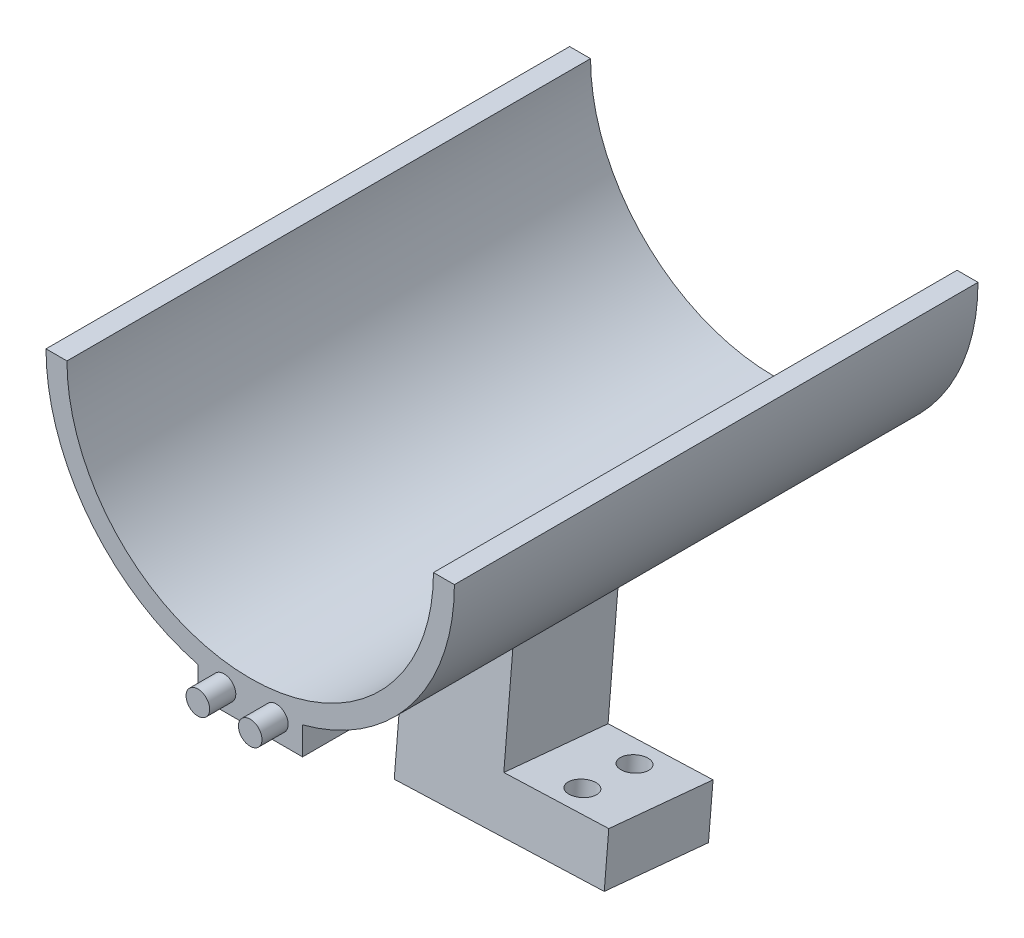
from build123d import *

# Parameters (mm, degrees)
EXTRUDE_THIN1_DEPTH       = 100
BOSS_EXTRUDE1_START       = -10
BOSS_EXTRUDE1_DEPTH       = 10
SKETCH3_R                 = 2.25
BOSS_EXTRUDE2_DEPTH       = 5
BOSS_EXTRUDE3_DEPTH       = 10
SKETCH5_R                 = 2.25
CUT_EXTRUDE1_DEPTH        = 6
BOSS_EXTRUDE4_REACH       = 121.416
BOSS_EXTRUDE4_END_RADIUS  = 39
SKETCH10_W                = 20
SKETCH10_H                = 20
BOSS_EXTRUDE5_START       = -29.189050103
BOSS_EXTRUDE5_OUTLINE_W   = 20
BOSS_EXTRUDE5_OUTLINE_H   = 20
BOSS_EXTRUDE5_DEPTH       = 29.189050103
BOSS_EXTRUDE5_START_2     = 80.604897745
BOSS_EXTRUDE5_2_OUTLINE_W = 23
BOSS_EXTRUDE5_2_OUTLINE_H = 23
BOSS_EXTRUDE5_2_DEPTH     = 1.395102255
BOSS_EXTRUDE6_DEPTH       = 20
SKETCH12_R                = 2.5
CUT_EXTRUDE2_DEPTH        = 20


with BuildPart() as part:
    # Sketch1 → Extrude-Thin1 (new body)
    with BuildSketch(Plane.XY):
        with BuildLine():
            ThreePointArc((-35, 0), (0, -35), (35, 0))
            Line((35, 0), (39, 0))
            ThreePointArc((39, 0), (0, -39), (-39, 0))
            Line((-39, 0), (-35, 0))
        make_face()
    extrude(amount=EXTRUDE_THIN1_DEPTH)

    # Sketch2 → Boss-Extrude1 (add)
    with BuildSketch(Plane.XY.offset(100).offset(BOSS_EXTRUDE1_START)):
        with BuildLine():
            Line((0, -39), (0, -35))
            Line((0, -35), (-10, -35))
            Line((-10, -35), (-10, -37.69615365))
            ThreePointArc((-10, -37.69615365), (-5.042321274, -38.672664715), (0, -39))
        make_face()
        with BuildLine():
            Line((10, -35), (0, -35))
            Line((0, -35), (0, -39))
            ThreePointArc((0, -39), (5.042321274, -38.672664715), (10, -37.69615365))
            Line((10, -37.69615365), (10, -35))
        make_face()
        with BuildLine():
            ThreePointArc((10, -37.69615365), (5.042321274, -38.672664715), (0, -39))
            ThreePointArc((0, -39), (-5.042321274, -38.672664715), (-10, -37.69615365))
            Line((-10, -37.69615365), (-10, -43))
            Line((-10, -43), (10, -43))
            Line((10, -43), (10, -37.69615365))
        make_face()
    extrude(amount=BOSS_EXTRUDE1_DEPTH)

    # Sketch3 → Boss-Extrude2 (add)
    with BuildSketch(Plane.XY.offset(100)):
        with Locations((-5, -39)):
            Circle(SKETCH3_R)
        with Locations((5, -39)):
            Circle(SKETCH3_R)
    extrude(amount=BOSS_EXTRUDE2_DEPTH)

    # Sketch4 → Boss-Extrude3 (add)
    with BuildSketch(Plane(origin=(0, 0, 0), x_dir=(-1, 0, 0), z_dir=(0, 0, -1))):
        with BuildLine():
            Line((0, -39), (0, -35))
            Line((0, -35), (-10, -35))
            Line((-10, -35), (-10, -37.69615365))
            ThreePointArc((-10, -37.69615365), (-5.042321274, -38.672664715), (0, -39))
        make_face()
        with BuildLine():
            ThreePointArc((10, -37.69615365), (5.042321274, -38.672664715), (0, -39))
            ThreePointArc((0, -39), (-5.042321274, -38.672664715), (-10, -37.69615365))
            Line((-10, -37.69615365), (-10, -43))
            Line((-10, -43), (10, -43))
            Line((10, -43), (10, -37.69615365))
        make_face()
        with BuildLine():
            Line((10, -35), (0, -35))
            Line((0, -35), (0, -39))
            ThreePointArc((0, -39), (5.042321274, -38.672664715), (10, -37.69615365))
            Line((10, -37.69615365), (10, -35))
        make_face()
    extrude(amount=-BOSS_EXTRUDE3_DEPTH)

    # Sketch5 → Cut-Extrude1 (cut)
    with BuildSketch(Plane(origin=(0, 0, 0), x_dir=(-1, 0, 0), z_dir=(0, 0, -1))):
        with Locations(Location((-5, -39, 0), (0, 0, 180))):
            Circle(SKETCH5_R)
        with Locations(Location((5, -39, 0), (0, 0, 180))):
            Circle(SKETCH5_R)
    extrude(amount=-CUT_EXTRUDE1_DEPTH, mode=Mode.SUBTRACT)

    # Boss-Extrude4: up to this cylinder (the profile starts outside it)
    boss_extrude4_end = Plane(origin=(0, 0, 50), z_dir=(0, 0, -1)) * Cylinder(BOSS_EXTRUDE4_END_RADIUS, 321.832, mode=Mode.PRIVATE)
    # Sketch10 → Boss-Extrude4 (add, up to the surface)
    with BuildSketch(Plane(origin=(0, -51.355775573, 4.493048169), x_dir=(1, 0, 0), z_dir=(0, 0.9961946980917462, -0.08715574274765152)), mode=Mode.PRIVATE) as boss_extrude4_sk1:
        with Locations((0, -45.680780994)):
            Rectangle(SKETCH10_W, SKETCH10_H)
    boss_extrude4_tool1 = extrude(boss_extrude4_sk1.sketch, amount=BOSS_EXTRUDE4_REACH, mode=Mode.PRIVATE) - boss_extrude4_end
    add(boss_extrude4_tool1.solids().sort_by_distance((0, -47.374433, 50))[0])

    # Boss-Extrude5: read off the stored shape, not the designer's step
    # Boss-Extrude5 outline → Boss-Extrude5 (add)
    with BuildSketch(Plane(origin=(0, -51.355775573, 4.493048169), x_dir=(1, 0, 0), z_dir=(0, 0.9961946980917462, -0.08715574274765152)).offset(BOSS_EXTRUDE5_START)):
        with Locations((0, -45.680780994)):
            Rectangle(BOSS_EXTRUDE5_OUTLINE_W, BOSS_EXTRUDE5_OUTLINE_H)
    extrude(amount=BOSS_EXTRUDE5_DEPTH)

    # Boss-Extrude5 2 outline → Boss-Extrude5 2 (cut)
    with BuildSketch(Plane(origin=(0, 0, 0), x_dir=(0.9994119135527714, 0.034137480457277325, -0.0032341114416132855), z_dir=(0.03429033462636031, -0.994956889147722, 0.09426007473315588)).offset(BOSS_EXTRUDE5_START_2)):
        with Locations((-2.5, 45.5)):
            Rectangle(BOSS_EXTRUDE5_2_OUTLINE_W, BOSS_EXTRUDE5_2_OUTLINE_H)
    extrude(amount=BOSS_EXTRUDE5_2_DEPTH, mode=Mode.SUBTRACT)

    # Sketch11 → Boss-Extrude6 (add, along a direction that is not the sketch's normal)
    with BuildSketch(Plane(origin=(10, 0, 0), x_dir=(0, 0, -1), z_dir=(1, 0, 0))):
        Polygon((-62.433599326, -74.753991325), (-42.522237652, -76.640350885), (-41.650680224, -66.678403904), (-61.562041898, -64.792044344), align=None)
    extrude(amount=BOSS_EXTRUDE6_DEPTH, dir=(0.999411883181242, 0.034160731366775, -0.002988676732389044))

    # Sketch12 → Cut-Extrude2 (cut)
    with BuildSketch(Plane(origin=(2.421276084, -70.254937612, 6.655801615), x_dir=(0.9994101830326217, 0.033961906388074226, -0.00508674406564492), z_dir=(-0.03429033462636031, 0.994956889147722, -0.09426007473315609))):
        with Locations(Location((17.489772292, -50.21182287, 0), (0, 0, 269.893376297))):
            Circle(SKETCH12_R)
        with Locations(Location((17.508382589, -40.211323595, 0), (0, 0, 269.893376297))):
            Circle(SKETCH12_R)
    extrude(amount=-CUT_EXTRUDE2_DEPTH, mode=Mode.SUBTRACT)


solid = part.part
